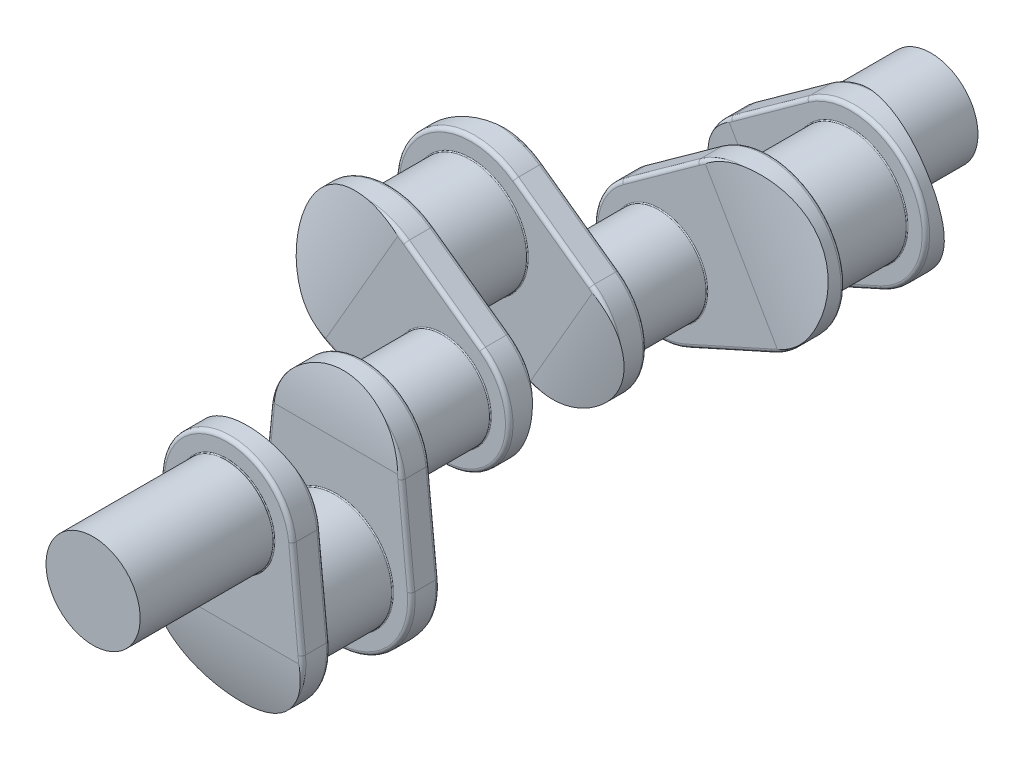
from build123d import *
from build123d.topology import SkipClean

# Parameters (mm, degrees)
SKETCH1_R             = 38.1
BOSS_EXTRUDE1_DEPTH   = 27.31
BOSS_EXTRUDE2_DEPTH   = 19
SKETCH3_R             = 31.75
BOSS_EXTRUDE3_DEPTH   = 26.67
CUT_EXTRUDE1_DEPTH    = 140.85679425755475
FILLET1_R             = 0.64
FILLET2_R             = 2.54
FILLET1_OF_MIRROR2_R  = 0.64
FILLET2_OF_MIRROR2_R  = 2.54
LPATTERN1_COUNT       = 3
LPATTERN1_PITCH       = 145.96
BODY_MOVE_COPY1_ANGLE = 120.00000000000027
BODY_MOVE_COPY2_ANGLE = 120.00000000000027
SKETCH5_R             = 31.75
BOSS_EXTRUDE4_DEPTH   = 63.5
BOSS_EXTRUDE5_START   = 63.5
SKETCH6_R             = 31.750000000000014
BOSS_EXTRUDE5_DEPTH   = 63.5


with BuildPart() as part:
    # Sketch1 → Boss-Extrude1 (new body)
    with BuildSketch(Plane.XY):
        Circle(SKETCH1_R)
    boss_extrude1 = extrude(amount=BOSS_EXTRUDE1_DEPTH)

    # Sketch2 → Boss-Extrude2 (add)
    with BuildSketch(Plane.XY.offset(27.31)):
        with BuildLine():
            Line((44.22719157938926, 67.945), (50.5453618050163, 5.079999999999991))
            ThreePointArc((50.5453618050163, 5.079999999999991), (-9.33e-15, -50.79999999999999), (-50.545361805016285, 5.079999999999994))
            Line((-50.545361805016285, 5.079999999999994), (-44.22719157938924, 67.945))
            ThreePointArc((-44.22719157938924, 67.945), (2.72e-15, 107.95), (44.22719157938926, 67.945))
        make_face()
    boss_extrude2 = extrude(amount=BOSS_EXTRUDE2_DEPTH)

    # Sketch3 → Boss-Extrude3 (add)
    with BuildSketch(Plane.XY.offset(46.309999999999995)):
        with Locations(Location((0, 63.5, 0), (0, 0, 180))):
            Circle(SKETCH3_R)
    boss_extrude3 = extrude(amount=BOSS_EXTRUDE3_DEPTH)

    # Sketch4 → Cut-Extrude1 (cut, symmetric)
    with BuildSketch(Plane(origin=(0, 0, 0), x_dir=(0, 0, -1), z_dir=(1, 0, 0))):
        with BuildLine():
            Line((-46.309999999999995, 8.7e-16), (-60.46480708613772, 0))
            Line((-60.46480708613772, 0), (-60.46480708613772, -50.8))
            Line((-60.46480708613772, -50.8), (-36.809999999999995, -50.8))
            ThreePointArc((-36.809999999999995, -50.8), (-43.51333122300713, -25.76528831926312), (-46.309999999999995, 8.7e-16))
        make_face()
        with BuildLine():
            Line((-27.31, 63.5), (-17.368068421826866, 63.5))
            Line((-17.368068421826866, 63.5), (-17.368068421826866, 107.94999999999999))
            Line((-17.368068421826866, 107.94999999999999), (-32.309999999999995, 107.94999999999999))
            ThreePointArc((-32.309999999999995, 107.94999999999999), (-28.332895265303648, 85.89115351346415), (-27.31, 63.5))
        make_face()
    cut_extrude1 = extrude(amount=CUT_EXTRUDE1_DEPTH, both=True, mode=Mode.SUBTRACT)

    # Fillet1
    fillet1_edges = [part.edges().sort_by_distance(p)[0] for p in [
        (31.75, 63.49999999999999, 46.309999999999995),
        (-38.1, 4.67e-15, 27.31),
    ]]
    fillet(fillet1_edges, radius=FILLET1_R)

    # Fillet2
    # the kernel refuses this fillet: 2.54 mm, written as the material it takes off along each edge
    with BuildSketch(Plane(origin=(8.88e-15, 1.066e-14, 46.31), x_dir=(0.99498743710662, 0.09999999999999962, 0), z_dir=(-0.09999999999999962, 0.99498743710662, 0))) as fillet2_piece_1:
        with BuildLine():
            CenterArc((50.800000000000004 - FILLET2_R, FILLET2_R), FILLET2_R, 270, 90)
            Line((50.800000000000004 - FILLET2_R, 0), (50.800000000000004, 0))
            Line((50.800000000000004, 0), (50.800000000000004, FILLET2_R))
        make_face()
    revolve(axis=Axis((8.88e-15, 1.066e-14, 46.31), (0, 0, -1)), revolution_arc=41.54909115261538, mode=Mode.SUBTRACT)
    with BuildSketch(Plane(origin=(8.88e-15, 1.066e-14, 46.31), x_dir=(-0.8109625223177599, -0.5850981006600661, 0), z_dir=(0.5850981006600661, -0.8109625223177599, 0))) as fillet2_piece_2:
        with BuildLine():
            CenterArc((50.8 - FILLET2_R, FILLET2_R), FILLET2_R, 270.00000000000017, 89.99999999999983)
            Line((50.8 - FILLET2_R, 0), (50.8, 0))
            Line((50.8, 0), (50.8, FILLET2_R))
        make_face()
    revolve(axis=Axis((8.88e-15, 1.066e-14, 46.31), (0, 0, -1)), revolution_arc=41.5490911526154, mode=Mode.SUBTRACT)
    with BuildSketch(Plane(origin=(-50.545361805016285, 5.079999999999995, 46.31), x_dir=(0, 0, -1), z_dir=(0.10000000000000009, 0.99498743710662, 0))) as fillet2_piece_3:
        with BuildLine():
            CenterArc((FILLET2_R, -FILLET2_R), FILLET2_R, 90, 90)
            Line((0, -FILLET2_R), (0, 0))
            Line((0, 0), (FILLET2_R, 0))
        make_face()
    extrude(amount=63.18170225627037, mode=Mode.SUBTRACT)
    with BuildSketch(Plane(origin=(1.243e-14, 63.5, 46.31), x_dir=(-0.9949874371066201, 0.09999999999999985, 0), z_dir=(-0.09999999999999985, -0.9949874371066201, 0))) as fillet2_piece_4:
        with BuildLine():
            CenterArc((44.45000000000001 - FILLET2_R, FILLET2_R), FILLET2_R, 270, 90)
            Line((44.45000000000001 - FILLET2_R, 0), (44.45000000000001, 0))
            Line((44.45000000000001, 0), (44.45000000000001, FILLET2_R))
        make_face()
    revolve(axis=Axis((1.243e-14, 63.5, 46.31), (0, 0, -1)), revolution_arc=168.52165904546644, mode=Mode.SUBTRACT)
    with BuildSketch(Plane(origin=(1.243e-14, 63.5, 27.31), x_dir=(-0.9949874371066201, 0.09999999999999985, 0), z_dir=(-0.09999999999999985, -0.9949874371066201, 0))) as fillet2_piece_5:
        with BuildLine():
            CenterArc((44.45000000000001 - FILLET2_R, -FILLET2_R), FILLET2_R, 0, 90)
            Line((44.45000000000001, -FILLET2_R), (44.45000000000001, 0))
            Line((44.45000000000001, 0), (44.45000000000001 - FILLET2_R, 0))
        make_face()
    revolve(axis=Axis((1.243e-14, 63.5, 27.31), (0, 0, -1)), revolution_arc=44.24752401387052, mode=Mode.SUBTRACT)
    with BuildSketch(Plane(origin=(-50.545361805016285, 5.079999999999995, 27.31), x_dir=(0.99498743710662, -0.1000000000000001, 0), z_dir=(0.1000000000000001, 0.99498743710662, 0))) as fillet2_piece_6:
        with BuildLine():
            CenterArc((FILLET2_R, -FILLET2_R), FILLET2_R, 90, 90)
            Line((0, -FILLET2_R), (0, 0))
            Line((0, 0), (FILLET2_R, 0))
        make_face()
    extrude(amount=63.18170225627036, mode=Mode.SUBTRACT)
    with BuildSketch(Plane(origin=(8.88e-15, 1.066e-14, 27.31), x_dir=(0.99498743710662, 0.09999999999999962, 0), z_dir=(-0.09999999999999962, 0.99498743710662, 0))) as fillet2_piece_7:
        with BuildLine():
            CenterArc((50.8 - FILLET2_R, -FILLET2_R), FILLET2_R, 0, 90)
            Line((50.8, -FILLET2_R), (50.8, 0))
            Line((50.8, 0), (50.8 - FILLET2_R, 0))
        make_face()
    revolve(axis=Axis((8.88e-15, 1.066e-14, 27.31), (0, 0, -1)), revolution_arc=191.47834095453354, mode=Mode.SUBTRACT)
    with BuildSketch(Plane(origin=(1.243e-14, 63.5, 27.31), x_dir=(0.6429654869762236, 0.7658951511515317, 0), z_dir=(-0.7658951511515317, 0.6429654869762236, 0))) as fillet2_piece_8:
        with BuildLine():
            CenterArc((44.45 - FILLET2_R, -FILLET2_R), FILLET2_R, 0, 90)
            Line((44.45, -FILLET2_R), (44.45, 0))
            Line((44.45, 0), (44.45 - FILLET2_R, 0))
        make_face()
    revolve(axis=Axis((1.243e-14, 63.5, 27.31), (0, 0, -1)), revolution_arc=44.247524013870525, mode=Mode.SUBTRACT)
    with BuildSketch(Plane(origin=(44.22719157938926, 67.945, 46.31), x_dir=(0, 0, -1), z_dir=(0.09999999999999998, -0.99498743710662, 0))) as fillet2_piece_9:
        with BuildLine():
            CenterArc((FILLET2_R, -FILLET2_R), FILLET2_R, 90, 90)
            Line((0, -FILLET2_R), (0, 0))
            Line((0, 0), (FILLET2_R, 0))
        make_face()
    extrude(amount=63.18170225627037, mode=Mode.SUBTRACT)
    with BuildSketch(Plane(origin=(50.5453618050163, 5.079999999999991, 27.31), x_dir=(-0.99498743710662, -0.09999999999999984, 0), z_dir=(-0.09999999999999988, 0.9949874371066201, 0))) as fillet2_piece_10:
        with BuildLine():
            CenterArc((FILLET2_R, FILLET2_R), FILLET2_R, 180, 90)
            Line((0, FILLET2_R), (0, 0))
            Line((0, 0), (FILLET2_R, 0))
        make_face()
    extrude(amount=63.18170225627038, mode=Mode.SUBTRACT)

    # Mirror2: Boss-Extrude1, Boss-Extrude2, Boss-Extrude3, Cut-Extrude1 across plane
    add(boss_extrude1.mirror(Plane.XY))
    add(boss_extrude2.mirror(Plane.XY))
    add(boss_extrude3.mirror(Plane.XY))
    add(cut_extrude1.mirror(Plane.XY), mode=Mode.SUBTRACT)

    # Fillet1 of Mirror2
    fillet1_of_mirror2_edges = [part.edges().sort_by_distance(p)[0] for p in [
        (31.75, 63.49999999999999, -46.309999999999995),
        (-38.1, 4.67e-15, -27.31),
    ]]
    fillet(fillet1_of_mirror2_edges, radius=FILLET1_OF_MIRROR2_R)

    # Fillet2 of Mirror2
    # the kernel refuses this fillet: 2.54 mm, written as the material it takes off along each edge
    with BuildSketch(Plane(origin=(8.88e-15, 1.066e-14, -46.31), x_dir=(0.99498743710662, 0.09999999999999962, 0), z_dir=(-0.09999999999999962, 0.99498743710662, 0))) as fillet2_of_mirror2_piece_1:
        with BuildLine():
            CenterArc((50.800000000000004 - FILLET2_OF_MIRROR2_R, -FILLET2_OF_MIRROR2_R), FILLET2_OF_MIRROR2_R, 0, 90)
            Line((50.800000000000004 - FILLET2_OF_MIRROR2_R, 0), (50.800000000000004, 0))
            Line((50.800000000000004, 0), (50.800000000000004, -FILLET2_OF_MIRROR2_R))
        make_face()
    revolve(axis=Axis((8.88e-15, 1.066e-14, -46.31), (0, 0, -1)), revolution_arc=41.54909115261538, mode=Mode.SUBTRACT)
    with BuildSketch(Plane(origin=(8.88e-15, 1.066e-14, -46.31), x_dir=(-0.8109625223177599, -0.5850981006600661, 0), z_dir=(0.5850981006600661, -0.8109625223177599, 0))) as fillet2_of_mirror2_piece_2:
        with BuildLine():
            CenterArc((50.8 - FILLET2_OF_MIRROR2_R, -FILLET2_OF_MIRROR2_R), FILLET2_OF_MIRROR2_R, 0, 89.99999999999984)
            Line((50.8 - FILLET2_OF_MIRROR2_R, 0), (50.8, 0))
            Line((50.8, 0), (50.8, -FILLET2_OF_MIRROR2_R))
        make_face()
    revolve(axis=Axis((8.88e-15, 1.066e-14, -46.31), (0, 0, -1)), revolution_arc=41.5490911526154, mode=Mode.SUBTRACT)
    with BuildSketch(Plane(origin=(-50.545361805016285, 5.079999999999995, -46.31), x_dir=(0, 0, 1), z_dir=(0.10000000000000009, 0.99498743710662, 0))) as fillet2_of_mirror2_piece_3:
        with BuildLine():
            CenterArc((FILLET2_OF_MIRROR2_R, FILLET2_OF_MIRROR2_R), FILLET2_OF_MIRROR2_R, 180, 90)
            Line((0, FILLET2_OF_MIRROR2_R), (0, 0))
            Line((0, 0), (FILLET2_OF_MIRROR2_R, 0))
        make_face()
    extrude(amount=63.18170225627037, mode=Mode.SUBTRACT)
    with BuildSketch(Plane(origin=(1.243e-14, 63.5, -46.31), x_dir=(-0.9949874371066201, 0.09999999999999985, 0), z_dir=(-0.09999999999999985, -0.9949874371066201, 0))) as fillet2_of_mirror2_piece_4:
        with BuildLine():
            CenterArc((44.45000000000001 - FILLET2_OF_MIRROR2_R, -FILLET2_OF_MIRROR2_R), FILLET2_OF_MIRROR2_R, 0, 90)
            Line((44.45000000000001 - FILLET2_OF_MIRROR2_R, 0), (44.45000000000001, 0))
            Line((44.45000000000001, 0), (44.45000000000001, -FILLET2_OF_MIRROR2_R))
        make_face()
    revolve(axis=Axis((1.243e-14, 63.5, -46.31), (0, 0, -1)), revolution_arc=168.52165904546644, mode=Mode.SUBTRACT)
    with BuildSketch(Plane(origin=(1.243e-14, 63.5, -27.31), x_dir=(-0.9949874371066201, 0.09999999999999985, 0), z_dir=(-0.09999999999999985, -0.9949874371066201, 0))) as fillet2_of_mirror2_piece_5:
        with BuildLine():
            CenterArc((44.45000000000001 - FILLET2_OF_MIRROR2_R, FILLET2_OF_MIRROR2_R), FILLET2_OF_MIRROR2_R, 270, 90)
            Line((44.45000000000001, FILLET2_OF_MIRROR2_R), (44.45000000000001, 0))
            Line((44.45000000000001, 0), (44.45000000000001 - FILLET2_OF_MIRROR2_R, 0))
        make_face()
    revolve(axis=Axis((1.243e-14, 63.5, -27.31), (0, 0, -1)), revolution_arc=44.24752401387052, mode=Mode.SUBTRACT)
    with BuildSketch(Plane(origin=(-44.22719157938924, 67.945, -27.31), x_dir=(0.99498743710662, -0.1000000000000001, 0), z_dir=(-0.1000000000000001, -0.99498743710662, 0))) as fillet2_of_mirror2_piece_6:
        with BuildLine():
            CenterArc((FILLET2_OF_MIRROR2_R, -FILLET2_OF_MIRROR2_R), FILLET2_OF_MIRROR2_R, 90, 90)
            Line((0, -FILLET2_OF_MIRROR2_R), (0, 0))
            Line((0, 0), (FILLET2_OF_MIRROR2_R, 0))
        make_face()
    extrude(amount=63.18170225627036, mode=Mode.SUBTRACT)
    with BuildSketch(Plane(origin=(8.88e-15, 1.066e-14, -27.31), x_dir=(0.99498743710662, 0.09999999999999962, 0), z_dir=(-0.09999999999999962, 0.99498743710662, 0))) as fillet2_of_mirror2_piece_7:
        with BuildLine():
            CenterArc((50.8 - FILLET2_OF_MIRROR2_R, FILLET2_OF_MIRROR2_R), FILLET2_OF_MIRROR2_R, 270, 90)
            Line((50.8, FILLET2_OF_MIRROR2_R), (50.8, 0))
            Line((50.8, 0), (50.8 - FILLET2_OF_MIRROR2_R, 0))
        make_face()
    revolve(axis=Axis((8.88e-15, 1.066e-14, -27.31), (0, 0, -1)), revolution_arc=191.47834095453354, mode=Mode.SUBTRACT)
    with BuildSketch(Plane(origin=(1.243e-14, 63.5, -27.31), x_dir=(0.6429654869762236, 0.7658951511515317, 0), z_dir=(-0.7658951511515317, 0.6429654869762236, 0))) as fillet2_of_mirror2_piece_8:
        with BuildLine():
            CenterArc((44.45 - FILLET2_OF_MIRROR2_R, FILLET2_OF_MIRROR2_R), FILLET2_OF_MIRROR2_R, 270, 90)
            Line((44.45, FILLET2_OF_MIRROR2_R), (44.45, 0))
            Line((44.45, 0), (44.45 - FILLET2_OF_MIRROR2_R, 0))
        make_face()
    revolve(axis=Axis((1.243e-14, 63.5, -27.31), (0, 0, -1)), revolution_arc=44.247524013870525, mode=Mode.SUBTRACT)
    with BuildSketch(Plane(origin=(44.22719157938926, 67.945, -46.31), x_dir=(0, 0, 1), z_dir=(0.09999999999999998, -0.99498743710662, 0))) as fillet2_of_mirror2_piece_9:
        with BuildLine():
            CenterArc((FILLET2_OF_MIRROR2_R, FILLET2_OF_MIRROR2_R), FILLET2_OF_MIRROR2_R, 180, 90)
            Line((0, FILLET2_OF_MIRROR2_R), (0, 0))
            Line((0, 0), (FILLET2_OF_MIRROR2_R, 0))
        make_face()
    extrude(amount=63.18170225627037, mode=Mode.SUBTRACT)
    with BuildSketch(Plane(origin=(44.22719157938927, 67.945, -27.31), x_dir=(-0.99498743710662, -0.09999999999999985, 0), z_dir=(0.09999999999999988, -0.9949874371066201, 0))) as fillet2_of_mirror2_piece_10:
        with BuildLine():
            CenterArc((FILLET2_OF_MIRROR2_R, FILLET2_OF_MIRROR2_R), FILLET2_OF_MIRROR2_R, 180, 90)
            Line((0, FILLET2_OF_MIRROR2_R), (0, 0))
            Line((0, 0), (FILLET2_OF_MIRROR2_R, 0))
        make_face()
    extrude(amount=63.18170225627038, mode=Mode.SUBTRACT)


with BuildPart() as lpattern1_1:
    # LPattern1: pattern copy
    add(part.part.moved(Location(Vector(0, 0, -1) * (1 * LPATTERN1_PITCH))))


with BuildPart() as lpattern1_2:
    # LPattern1: pattern copy
    add(part.part.moved(Location(Vector(0, 0, -1) * (2 * LPATTERN1_PITCH))))


with BuildPart() as lpattern1_1_1:
    # Body-Move/Copy1: moved
    add(lpattern1_1.part.rotate(Axis((0, 63.5, 0), (0, 0, -1)), BODY_MOVE_COPY1_ANGLE))


with BuildPart() as lpattern1_2_1:
    # Body-Move/Copy2: moved
    add(lpattern1_2.part.rotate(Axis((0, 63.5, 0), (0, 0, 1)), BODY_MOVE_COPY2_ANGLE))


with BuildPart() as part_1:
    add(part.part)

    # Combine1: union LPattern1_1, LPattern1_2
    add(lpattern1_1_1.part)
    add(lpattern1_2_1.part)

    # Sketch5 → Boss-Extrude4 (add)
    with SkipClean():  # the faces are left unmerged after this step: merging them gives an invalid solid
        with BuildSketch(Plane.XY.offset(72.98)):
            with Locations(Location((0, 63.5, 0), (0, 0, 180))):
                Circle(SKETCH5_R)
        extrude(amount=BOSS_EXTRUDE4_DEPTH)

    # Sketch6 → Boss-Extrude5 (add)
    with SkipClean():  # the faces are left unmerged after this step: merging them gives an invalid solid
        with BuildSketch(Plane(origin=(0, 0, -364.9), x_dir=(-1, 0, 0), z_dir=(0, 0, -1)).offset(BOSS_EXTRUDE5_START)):
            with Locations((0, 63.5)):
                Circle(SKETCH6_R)
        extrude(amount=-BOSS_EXTRUDE5_DEPTH)


solid = part_1.part
